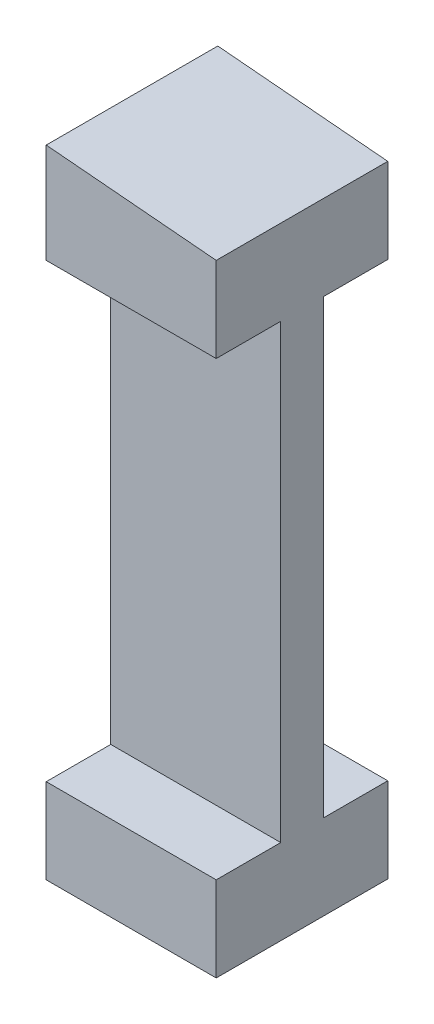
from build123d import *

# Parameters (mm, degrees)
BOSS_EXTRUDE1_START     = -40.32571447
BOSS_EXTRUDE1_DEPTH     = 80.704842411
CUT_EXTRUDE1_DEPTH      = 313.486325482
CUT_EXTRUDE1_DEPTH_BACK = 313.486325482
SKETCH2_W               = 30.352421206
SKETCH2_H               = 220
SKETCH2_W_2             = 30.352421205
SKETCH2_H_2             = 212.373598339
SKETCH5_W               = 79.968077757
SKETCH5_H               = 30.352421206
BOSS_EXTRUDE2_DEPTH     = 7.626401661


# Read off the part's stored shape, not the designer's step: Boss-Extrude1
with BuildPart() as part:
    # Boss-Extrude1 outline → Boss-Extrude1 (new body)
    with BuildSketch(Plane.XY.offset(BOSS_EXTRUDE1_START)):
        Polygon((-31.568063376, 299.369898587), (-31.568063376, 0), (48.400014381, 0), (48.400014381, 292.373598339), align=None)
    extrude(amount=BOSS_EXTRUDE1_DEPTH)

    # Sketch2 → Cut-Extrude1 (cut, two sides: drawn at the far end of the back side and taken through both)
    with BuildSketch(Plane(origin=(48.400014381, 0, 0), x_dir=(0, 0, -1), z_dir=(1, 0, 0)).offset(-CUT_EXTRUDE1_DEPTH_BACK)):
        with Locations((-25.202917338, 150)):
            Rectangle(SKETCH2_W, SKETCH2_H)
        with Locations((25.149503868, 146.18679917)):
            Rectangle(SKETCH2_W_2, SKETCH2_H_2)
    extrude(amount=CUT_EXTRUDE1_DEPTH + CUT_EXTRUDE1_DEPTH_BACK, mode=Mode.SUBTRACT)

    # Sketch5 → Boss-Extrude2 (add)
    with BuildSketch(Plane.XZ.offset(-260)):
        with Locations((8.415975503, 25.202917338)):
            Rectangle(SKETCH5_W, SKETCH5_H)
    extrude(amount=BOSS_EXTRUDE2_DEPTH)


solid = part.part
